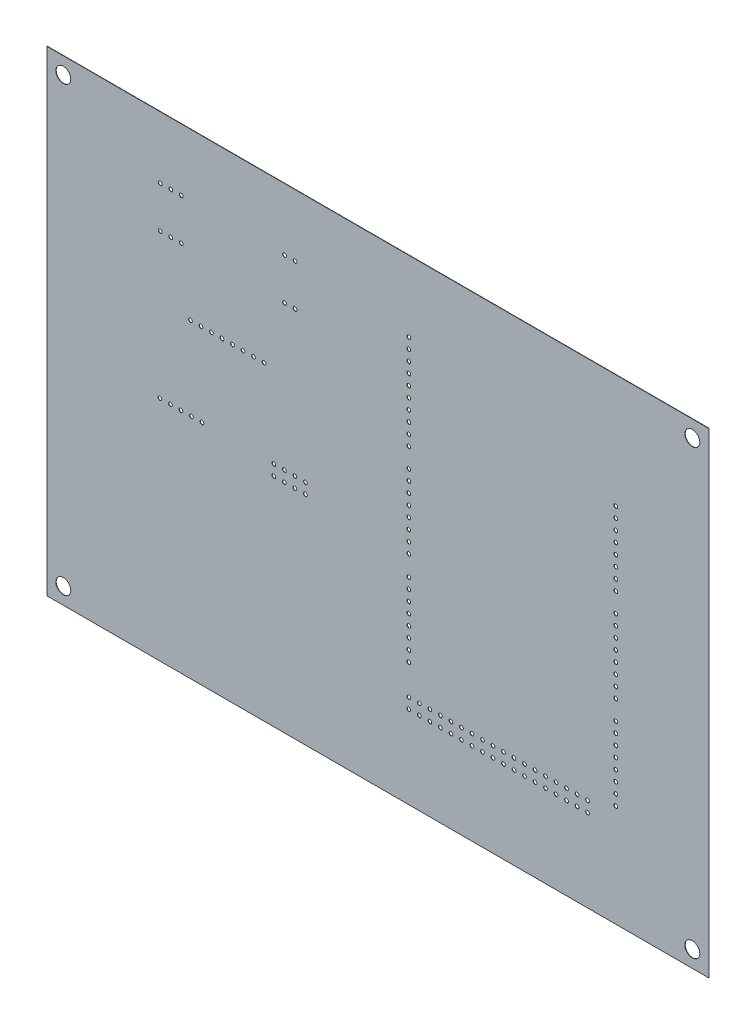
from build123d import *

# Parameters (mm, degrees)
SKETCH1_W                          = 160
SKETCH1_H                          = 115.000001
BOARD_DEPTH                        = 0.08128
F_1_0_228_DIAMETER_HOLE1_OUTLINE_R = 0.4500005
F_1_0_228_DIAMETER_HOLE1_DEPTH     = 0.08128
M3_CLEARANCE_HOLE1_D               = 3.6


# Read off the part's stored shape, not the designer's step: #1 (0.228) Diameter Hole1
with BuildPart() as part:
    # Sketch1 → Board (new body)
    with BuildSketch(Plane.XY):
        with Locations((105.4, 82.9000005)):
            Rectangle(SKETCH1_W, SKETCH1_H)
    extrude(amount=BOARD_DEPTH)

    # #1 (0.228) Diameter Hole1 outline → #1 (0.228) Diameter Hole1 (cut)
    with BuildSketch(Plane.XY):
        with Locations((60.119999, 100.4)):
            Circle(F_1_0_228_DIAMETER_HOLE1_OUTLINE_R)
        with Locations((62.659999, 100.4)):
            Circle(F_1_0_228_DIAMETER_HOLE1_OUTLINE_R)
        with Locations((65.199999, 100.4)):
            Circle(F_1_0_228_DIAMETER_HOLE1_OUTLINE_R)
        with Locations((67.739999, 100.4)):
            Circle(F_1_0_228_DIAMETER_HOLE1_OUTLINE_R)
        with Locations((70.279999, 100.4)):
            Circle(F_1_0_228_DIAMETER_HOLE1_OUTLINE_R)
        with Locations((72.819999, 100.4)):
            Circle(F_1_0_228_DIAMETER_HOLE1_OUTLINE_R)
        with Locations((75.359999, 100.4)):
            Circle(F_1_0_228_DIAMETER_HOLE1_OUTLINE_R)
        with Locations((77.899999, 100.4)):
            Circle(F_1_0_228_DIAMETER_HOLE1_OUTLINE_R)
        with Locations((82.859999, 125.400001)):
            Circle(F_1_0_228_DIAMETER_HOLE1_OUTLINE_R)
        with Locations((85.399999, 125.400001)):
            Circle(F_1_0_228_DIAMETER_HOLE1_OUTLINE_R)
        with Locations((112.899995, 47.899991)):
            Circle(F_1_0_228_DIAMETER_HOLE1_OUTLINE_R)
        with Locations((112.899995, 45.359991)):
            Circle(F_1_0_228_DIAMETER_HOLE1_OUTLINE_R)
        with Locations((115.439995, 47.899991)):
            Circle(F_1_0_228_DIAMETER_HOLE1_OUTLINE_R)
        with Locations((115.439995, 45.359991)):
            Circle(F_1_0_228_DIAMETER_HOLE1_OUTLINE_R)
        with Locations((117.979995, 47.899991)):
            Circle(F_1_0_228_DIAMETER_HOLE1_OUTLINE_R)
        with Locations((117.979995, 45.359991)):
            Circle(F_1_0_228_DIAMETER_HOLE1_OUTLINE_R)
        with Locations((120.519995, 47.899991)):
            Circle(F_1_0_228_DIAMETER_HOLE1_OUTLINE_R)
        with Locations((120.519995, 45.359991)):
            Circle(F_1_0_228_DIAMETER_HOLE1_OUTLINE_R)
        with Locations((123.059995, 47.899991)):
            Circle(F_1_0_228_DIAMETER_HOLE1_OUTLINE_R)
        with Locations((123.059995, 45.359991)):
            Circle(F_1_0_228_DIAMETER_HOLE1_OUTLINE_R)
        with Locations((125.599995, 47.899991)):
            Circle(F_1_0_228_DIAMETER_HOLE1_OUTLINE_R)
        with Locations((125.599995, 45.359991)):
            Circle(F_1_0_228_DIAMETER_HOLE1_OUTLINE_R)
        with Locations((128.139995, 47.899991)):
            Circle(F_1_0_228_DIAMETER_HOLE1_OUTLINE_R)
        with Locations((128.139995, 45.359991)):
            Circle(F_1_0_228_DIAMETER_HOLE1_OUTLINE_R)
        with Locations((130.679995, 47.899991)):
            Circle(F_1_0_228_DIAMETER_HOLE1_OUTLINE_R)
        with Locations((130.679995, 45.359991)):
            Circle(F_1_0_228_DIAMETER_HOLE1_OUTLINE_R)
        with Locations((133.219995, 47.899991)):
            Circle(F_1_0_228_DIAMETER_HOLE1_OUTLINE_R)
        with Locations((133.219995, 45.359991)):
            Circle(F_1_0_228_DIAMETER_HOLE1_OUTLINE_R)
        with Locations((135.759995, 47.899991)):
            Circle(F_1_0_228_DIAMETER_HOLE1_OUTLINE_R)
        with Locations((135.759995, 45.359991)):
            Circle(F_1_0_228_DIAMETER_HOLE1_OUTLINE_R)
        with Locations((138.299995, 47.899991)):
            Circle(F_1_0_228_DIAMETER_HOLE1_OUTLINE_R)
        with Locations((138.299995, 45.359991)):
            Circle(F_1_0_228_DIAMETER_HOLE1_OUTLINE_R)
        with Locations((140.839995, 47.899991)):
            Circle(F_1_0_228_DIAMETER_HOLE1_OUTLINE_R)
        with Locations((140.839995, 45.359991)):
            Circle(F_1_0_228_DIAMETER_HOLE1_OUTLINE_R)
        with Locations((143.379995, 47.899991)):
            Circle(F_1_0_228_DIAMETER_HOLE1_OUTLINE_R)
        with Locations((143.379995, 45.359991)):
            Circle(F_1_0_228_DIAMETER_HOLE1_OUTLINE_R)
        with Locations((145.919995, 47.899991)):
            Circle(F_1_0_228_DIAMETER_HOLE1_OUTLINE_R)
        with Locations((145.919995, 45.359991)):
            Circle(F_1_0_228_DIAMETER_HOLE1_OUTLINE_R)
        with Locations((148.459995, 47.899991)):
            Circle(F_1_0_228_DIAMETER_HOLE1_OUTLINE_R)
        with Locations((148.459995, 45.359991)):
            Circle(F_1_0_228_DIAMETER_HOLE1_OUTLINE_R)
        with Locations((150.999995, 47.899991)):
            Circle(F_1_0_228_DIAMETER_HOLE1_OUTLINE_R)
        with Locations((150.999995, 45.359991)):
            Circle(F_1_0_228_DIAMETER_HOLE1_OUTLINE_R)
        with Locations((153.539995, 47.899991)):
            Circle(F_1_0_228_DIAMETER_HOLE1_OUTLINE_R)
        with Locations((153.539995, 45.359991)):
            Circle(F_1_0_228_DIAMETER_HOLE1_OUTLINE_R)
        with Locations((156.079995, 47.899991)):
            Circle(F_1_0_228_DIAMETER_HOLE1_OUTLINE_R)
        with Locations((156.079995, 45.359991)):
            Circle(F_1_0_228_DIAMETER_HOLE1_OUTLINE_R)
        with Locations((82.859999, 115.4)):
            Circle(F_1_0_228_DIAMETER_HOLE1_OUTLINE_R)
        with Locations((85.399999, 115.4)):
            Circle(F_1_0_228_DIAMETER_HOLE1_OUTLINE_R)
        with Locations((62.900001, 80.399999)):
            Circle(F_1_0_228_DIAMETER_HOLE1_OUTLINE_R)
        with Locations((60.360001, 80.399999)):
            Circle(F_1_0_228_DIAMETER_HOLE1_OUTLINE_R)
        with Locations((57.820001, 80.399999)):
            Circle(F_1_0_228_DIAMETER_HOLE1_OUTLINE_R)
        with Locations((55.280001, 80.399999)):
            Circle(F_1_0_228_DIAMETER_HOLE1_OUTLINE_R)
        with Locations((52.740001, 80.399999)):
            Circle(F_1_0_228_DIAMETER_HOLE1_OUTLINE_R)
        with Locations((112.900005, 73.020022)):
            Circle(F_1_0_228_DIAMETER_HOLE1_OUTLINE_R)
        with Locations((112.900005, 70.480022)):
            Circle(F_1_0_228_DIAMETER_HOLE1_OUTLINE_R)
        with Locations((112.900005, 67.940022)):
            Circle(F_1_0_228_DIAMETER_HOLE1_OUTLINE_R)
        with Locations((112.900005, 65.400022)):
            Circle(F_1_0_228_DIAMETER_HOLE1_OUTLINE_R)
        with Locations((112.900005, 62.860022)):
            Circle(F_1_0_228_DIAMETER_HOLE1_OUTLINE_R)
        with Locations((112.900005, 60.320022)):
            Circle(F_1_0_228_DIAMETER_HOLE1_OUTLINE_R)
        with Locations((112.900005, 57.780022)):
            Circle(F_1_0_228_DIAMETER_HOLE1_OUTLINE_R)
        with Locations((112.900005, 55.240022)):
            Circle(F_1_0_228_DIAMETER_HOLE1_OUTLINE_R)
        with Locations((162.900002, 50.120012)):
            Circle(F_1_0_228_DIAMETER_HOLE1_OUTLINE_R)
        with Locations((162.900002, 52.660012)):
            Circle(F_1_0_228_DIAMETER_HOLE1_OUTLINE_R)
        with Locations((162.900002, 55.200012)):
            Circle(F_1_0_228_DIAMETER_HOLE1_OUTLINE_R)
        with Locations((162.900002, 57.740012)):
            Circle(F_1_0_228_DIAMETER_HOLE1_OUTLINE_R)
        with Locations((162.900002, 60.280012)):
            Circle(F_1_0_228_DIAMETER_HOLE1_OUTLINE_R)
        with Locations((162.900002, 62.820012)):
            Circle(F_1_0_228_DIAMETER_HOLE1_OUTLINE_R)
        with Locations((162.900002, 65.360012)):
            Circle(F_1_0_228_DIAMETER_HOLE1_OUTLINE_R)
        with Locations((162.900002, 67.900012)):
            Circle(F_1_0_228_DIAMETER_HOLE1_OUTLINE_R)
        with Locations((52.820001, 115.4)):
            Circle(F_1_0_228_DIAMETER_HOLE1_OUTLINE_R)
        with Locations((55.360001, 115.4)):
            Circle(F_1_0_228_DIAMETER_HOLE1_OUTLINE_R)
        with Locations((57.900001, 115.4)):
            Circle(F_1_0_228_DIAMETER_HOLE1_OUTLINE_R)
        with Locations((112.900005, 95.680025)):
            Circle(F_1_0_228_DIAMETER_HOLE1_OUTLINE_R)
        with Locations((112.900005, 93.140025)):
            Circle(F_1_0_228_DIAMETER_HOLE1_OUTLINE_R)
        with Locations((112.900005, 90.600025)):
            Circle(F_1_0_228_DIAMETER_HOLE1_OUTLINE_R)
        with Locations((112.900005, 88.060025)):
            Circle(F_1_0_228_DIAMETER_HOLE1_OUTLINE_R)
        with Locations((112.900005, 85.520025)):
            Circle(F_1_0_228_DIAMETER_HOLE1_OUTLINE_R)
        with Locations((112.900005, 82.980025)):
            Circle(F_1_0_228_DIAMETER_HOLE1_OUTLINE_R)
        with Locations((112.900005, 80.440025)):
            Circle(F_1_0_228_DIAMETER_HOLE1_OUTLINE_R)
        with Locations((112.900005, 77.900025)):
            Circle(F_1_0_228_DIAMETER_HOLE1_OUTLINE_R)
        with Locations((52.820001, 125.400001)):
            Circle(F_1_0_228_DIAMETER_HOLE1_OUTLINE_R)
        with Locations((55.360001, 125.400001)):
            Circle(F_1_0_228_DIAMETER_HOLE1_OUTLINE_R)
        with Locations((57.900001, 125.400001)):
            Circle(F_1_0_228_DIAMETER_HOLE1_OUTLINE_R)
        with Locations((162.900002, 72.620043)):
            Circle(F_1_0_228_DIAMETER_HOLE1_OUTLINE_R)
        with Locations((162.900002, 75.160043)):
            Circle(F_1_0_228_DIAMETER_HOLE1_OUTLINE_R)
        with Locations((162.900002, 77.700043)):
            Circle(F_1_0_228_DIAMETER_HOLE1_OUTLINE_R)
        with Locations((162.900002, 80.240043)):
            Circle(F_1_0_228_DIAMETER_HOLE1_OUTLINE_R)
        with Locations((162.900002, 82.780043)):
            Circle(F_1_0_228_DIAMETER_HOLE1_OUTLINE_R)
        with Locations((162.900002, 85.320043)):
            Circle(F_1_0_228_DIAMETER_HOLE1_OUTLINE_R)
        with Locations((162.900002, 87.860043)):
            Circle(F_1_0_228_DIAMETER_HOLE1_OUTLINE_R)
        with Locations((162.900002, 90.400043)):
            Circle(F_1_0_228_DIAMETER_HOLE1_OUTLINE_R)
        with Locations((87.899999, 80.399999)):
            Circle(F_1_0_228_DIAMETER_HOLE1_OUTLINE_R)
        with Locations((85.359999, 80.399999)):
            Circle(F_1_0_228_DIAMETER_HOLE1_OUTLINE_R)
        with Locations((82.819999, 80.399999)):
            Circle(F_1_0_228_DIAMETER_HOLE1_OUTLINE_R)
        with Locations((80.279999, 80.399999)):
            Circle(F_1_0_228_DIAMETER_HOLE1_OUTLINE_R)
        with Locations((87.899999, 77.859999)):
            Circle(F_1_0_228_DIAMETER_HOLE1_OUTLINE_R)
        with Locations((85.359999, 77.859999)):
            Circle(F_1_0_228_DIAMETER_HOLE1_OUTLINE_R)
        with Locations((82.819999, 77.859999)):
            Circle(F_1_0_228_DIAMETER_HOLE1_OUTLINE_R)
        with Locations((80.279999, 77.859999)):
            Circle(F_1_0_228_DIAMETER_HOLE1_OUTLINE_R)
        with Locations((162.900002, 95.119972)):
            Circle(F_1_0_228_DIAMETER_HOLE1_OUTLINE_R)
        with Locations((162.900002, 97.659972)):
            Circle(F_1_0_228_DIAMETER_HOLE1_OUTLINE_R)
        with Locations((162.900002, 100.199972)):
            Circle(F_1_0_228_DIAMETER_HOLE1_OUTLINE_R)
        with Locations((162.900002, 102.739972)):
            Circle(F_1_0_228_DIAMETER_HOLE1_OUTLINE_R)
        with Locations((162.900002, 105.279972)):
            Circle(F_1_0_228_DIAMETER_HOLE1_OUTLINE_R)
        with Locations((162.900002, 107.819972)):
            Circle(F_1_0_228_DIAMETER_HOLE1_OUTLINE_R)
        with Locations((162.900002, 110.359972)):
            Circle(F_1_0_228_DIAMETER_HOLE1_OUTLINE_R)
        with Locations((162.900002, 112.899972)):
            Circle(F_1_0_228_DIAMETER_HOLE1_OUTLINE_R)
        with Locations((112.900005, 100.400005)):
            Circle(F_1_0_228_DIAMETER_HOLE1_OUTLINE_R)
        with Locations((112.900005, 102.940005)):
            Circle(F_1_0_228_DIAMETER_HOLE1_OUTLINE_R)
        with Locations((112.900005, 108.020005)):
            Circle(F_1_0_228_DIAMETER_HOLE1_OUTLINE_R)
        with Locations((112.900005, 110.560005)):
            Circle(F_1_0_228_DIAMETER_HOLE1_OUTLINE_R)
        with Locations((112.900005, 113.100005)):
            Circle(F_1_0_228_DIAMETER_HOLE1_OUTLINE_R)
        with Locations((112.900005, 115.640005)):
            Circle(F_1_0_228_DIAMETER_HOLE1_OUTLINE_R)
        with Locations((112.900005, 118.180005)):
            Circle(F_1_0_228_DIAMETER_HOLE1_OUTLINE_R)
        with Locations((112.900005, 120.720005)):
            Circle(F_1_0_228_DIAMETER_HOLE1_OUTLINE_R)
        with Locations((112.900005, 123.260005)):
            Circle(F_1_0_228_DIAMETER_HOLE1_OUTLINE_R)
        with Locations((112.900005, 105.480005)):
            Circle(F_1_0_228_DIAMETER_HOLE1_OUTLINE_R)
    extrude(amount=F_1_0_228_DIAMETER_HOLE1_DEPTH, mode=Mode.SUBTRACT)

    # M3 Clearance Hole1 (through all)
    with Locations(Plane.XY.offset(0.08128)):
        with Locations((29.4, 136.400001), (181.4, 136.400001), (181.4, 29.4), (29.4, 29.4)):
            Hole(M3_CLEARANCE_HOLE1_D / 2)


solid = part.part
